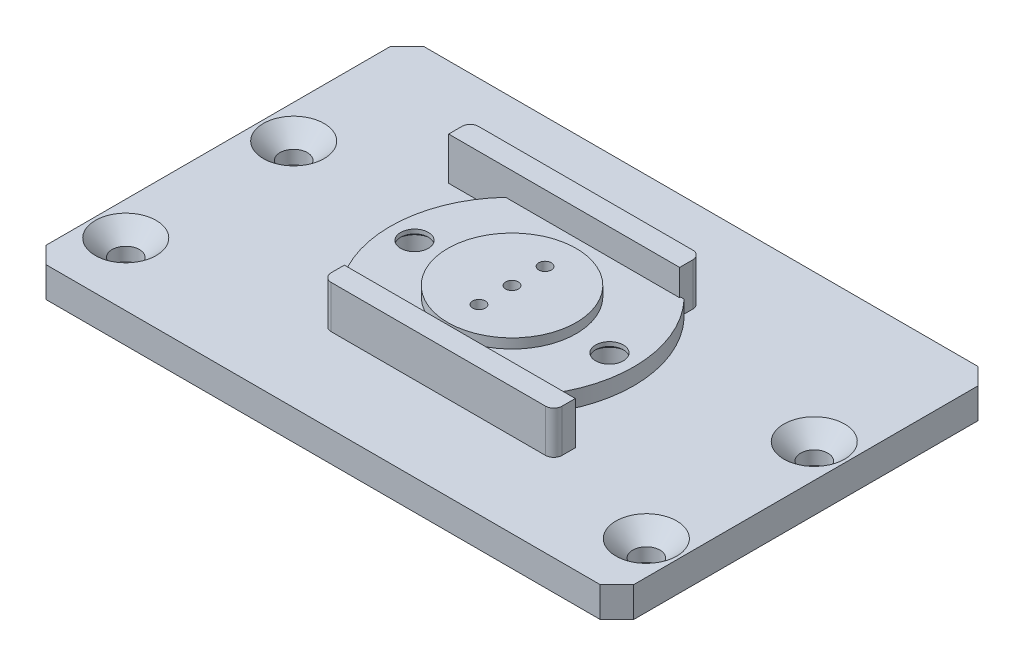
from build123d import *

# Parameters (mm, degrees)
SKETCH1_R           = 7.65
SKETCH1_R_2         = 0.75
BOSS_EXTRUDE1_DEPTH = 3.103
SKETCH1_3_R         = 2.1
SKETCH1_3_R_2       = 7.65
BOSS_EXTRUDE2_DEPTH = 1.95
SKETCH2_W           = 27.509
SKETCH2_H           = 2.566
BOSS_EXTRUDE3_DEPTH = 5.084
BOSS_EXTRUDE4_START = 0.4
SKETCH3_W           = 70
SKETCH3_H           = 45
SKETCH3_R           = 2.1
SKETCH3_R_2         = 1.625
SKETCH3_R_3         = 0.75
BOSS_EXTRUDE4_DEPTH = 0.4
BOSS_EXTRUDE5_START = 3.6
SKETCH3_3_W         = 70
SKETCH3_3_H         = 45
SKETCH3_3_R         = 2.1
SKETCH3_3_R_2       = 6.404
SKETCH3_3_R_3       = 1.625
BOSS_EXTRUDE5_DEPTH = 3.6
FILLET1_R           = 1
BOSS_EXTRUDE7_START = 0.5
SKETCH4_R           = 6.404
SKETCH4_R_2         = 1
BOSS_EXTRUDE7_DEPTH = 0.5
BOSS_EXTRUDE8_START = 0.3
BOSS_EXTRUDE8_DEPTH = 0.3
SKETCH6_R           = 2.125
SKETCH6_R_2         = 1.65
BOSS_EXTRUDE9_DEPTH = 0.5
CHAMFER2_SIZE       = 0.4
CHAMFER3_SIZE       = 2
CHAMFER4_SIZE       = 2


with BuildPart() as part:
    # Sketch1 → Boss-Extrude1 (new body)
    with BuildSketch(Plane(origin=(0, 0, 0), x_dir=(1, 0, 0), z_dir=(0, 1, 0))):
        Circle(SKETCH1_R)
        with Locations((0, -3.937)):
            Circle(SKETCH1_R_2, mode=Mode.SUBTRACT)
        Circle(SKETCH1_R_2, mode=Mode.SUBTRACT)
        with Locations((0, 3.937)):
            Circle(SKETCH1_R_2, mode=Mode.SUBTRACT)
    extrude(amount=BOSS_EXTRUDE1_DEPTH)

    # Sketch1<3> → Boss-Extrude2 (add)
    with BuildSketch(Plane(origin=(0, 0, 0), x_dir=(1, 0, 0), z_dir=(0, 1, 0))):
        with BuildLine():
            ThreePointArc((-10.5, 10), (-14.5, 0), (-10.5, -10))
            Line((-10.5, -10), (10.5, -10))
            ThreePointArc((10.5, -10), (14.5, 0), (10.5, 10))
            Line((10.5, 10), (-10.5, 10))
        make_face()
        with Locations((-11.608, 0)):
            Circle(SKETCH1_3_R, mode=Mode.SUBTRACT)
        with Locations((11.608, 0)):
            Circle(SKETCH1_3_R, mode=Mode.SUBTRACT)
        Circle(SKETCH1_3_R_2, mode=Mode.SUBTRACT)
    extrude(amount=BOSS_EXTRUDE2_DEPTH)

    # Sketch2 → Boss-Extrude3 (add)
    with BuildSketch(Plane.XZ):
        with Locations((3.654588862, 11.149)):
            Rectangle(SKETCH2_W, SKETCH2_H)
        with Locations((-3.654588862, -11.149)):
            Rectangle(SKETCH2_W, SKETCH2_H)
    extrude(amount=-BOSS_EXTRUDE3_DEPTH)

    # Sketch3 → Boss-Extrude4 (add)
    with BuildSketch(Plane.XZ.offset(BOSS_EXTRUDE4_START)):
        Rectangle(SKETCH3_W, SKETCH3_H)
        with Locations((-11.608, 0)):
            Circle(SKETCH3_R, mode=Mode.SUBTRACT)
        with Locations((11.608, 0)):
            Circle(SKETCH3_R, mode=Mode.SUBTRACT)
        with Locations((-31, -5)):
            Circle(SKETCH3_R_2, mode=Mode.SUBTRACT)
        with Locations((31, -5)):
            Circle(SKETCH3_R_2, mode=Mode.SUBTRACT)
        with Locations((-31, 15)):
            Circle(SKETCH3_R_2, mode=Mode.SUBTRACT)
        with Locations((31, 15)):
            Circle(SKETCH3_R_2, mode=Mode.SUBTRACT)
        with Locations((0, 3.937)):
            Circle(SKETCH3_R_3, mode=Mode.SUBTRACT)
        with Locations((0, -3.937)):
            Circle(SKETCH3_R_3, mode=Mode.SUBTRACT)
        Circle(SKETCH3_R_3, mode=Mode.SUBTRACT)
    extrude(amount=-BOSS_EXTRUDE4_DEPTH)

    # Sketch3<3> → Boss-Extrude5 (add)
    with BuildSketch(Plane.XZ.offset(BOSS_EXTRUDE5_START)):
        Rectangle(SKETCH3_3_W, SKETCH3_3_H)
        with Locations((-11.608, 0)):
            Circle(SKETCH3_3_R, mode=Mode.SUBTRACT)
        Circle(SKETCH3_3_R_2, mode=Mode.SUBTRACT)
        with Locations((11.608, 0)):
            Circle(SKETCH3_3_R, mode=Mode.SUBTRACT)
        with Locations((-31, -5)):
            Circle(SKETCH3_3_R_3, mode=Mode.SUBTRACT)
        with Locations((31, -5)):
            Circle(SKETCH3_3_R_3, mode=Mode.SUBTRACT)
        with Locations((-31, 15)):
            Circle(SKETCH3_3_R_3, mode=Mode.SUBTRACT)
        with Locations((31, 15)):
            Circle(SKETCH3_3_R_3, mode=Mode.SUBTRACT)
    extrude(amount=-BOSS_EXTRUDE5_DEPTH)

    # Fillet1
    fillet1_edges = [part.edges().sort_by_distance(p)[0] for p in [
        (-17.409088862, 2.542, -12.432),
        (10.099911138, 2.542, -12.432),
        (17.409088862, 2.542, 12.432),
        (-10.099911138, 2.542, 12.432),
    ]]
    fillet(fillet1_edges, radius=FILLET1_R)

    # Sketch4 → Boss-Extrude7 (add)
    with BuildSketch(Plane.XZ.offset(0.4).offset(BOSS_EXTRUDE7_START)):
        Circle(SKETCH4_R)
        Circle(SKETCH4_R_2, mode=Mode.SUBTRACT)
        with Locations((0, -3.937)):
            Circle(SKETCH4_R_2, mode=Mode.SUBTRACT)
        with Locations((0, 3.937)):
            Circle(SKETCH4_R_2, mode=Mode.SUBTRACT)
    extrude(amount=-BOSS_EXTRUDE7_DEPTH)

    # Sketch5 → Boss-Extrude8 (add)
    with BuildSketch(Plane.XZ.offset(0.9).offset(BOSS_EXTRUDE8_START)):
        with BuildLine():
            Line((-1, -6.325441961), (-1, 6.325441961))
            ThreePointArc((-1, 6.325441961), (-6.404, 0), (-1, -6.325441961))
        make_face()
        with BuildLine():
            ThreePointArc((1, -6.325441961), (6.404, 0), (1, 6.325441961))
            Line((1, 6.325441961), (1, -6.325441961))
        make_face()
    extrude(amount=-BOSS_EXTRUDE8_DEPTH)

    # Sketch6 → Boss-Extrude9 (add)
    # profile 1 of 2: a face of its own
    with BuildSketch(Plane(origin=(0, 1.95, 0), x_dir=(1, 0, 0), z_dir=(0, 1, 0))):
        with Locations((-11.608, 0)):
            Circle(SKETCH6_R)
        with Locations((-11.608, 0)):
            Circle(SKETCH6_R_2, mode=Mode.SUBTRACT)
    # profile 2 of 2: a face of its own
    with BuildSketch(Plane(origin=(0, 1.95, 0), x_dir=(1, 0, 0), z_dir=(0, 1, 0))):
        with Locations((11.608, 0)):
            Circle(SKETCH6_R)
        with Locations((11.608, 0)):
            Circle(SKETCH6_R_2, mode=Mode.SUBTRACT)
    extrude(amount=-BOSS_EXTRUDE9_DEPTH)

    # Chamfer2
    chamfer2_edges = [part.edges().sort_by_distance(p)[0] for p in [
        (-13.708, 1.45, 0),
        (9.508, 1.45, 0),
    ]]
    chamfer(chamfer2_edges, length=CHAMFER2_SIZE)

    # Chamfer3
    chamfer3_edges = [part.edges().sort_by_distance(p)[0] for p in [
        (-35, -1.8, -22.5),
        (35, -1.8, -22.5),
        (-35, -1.8, 22.5),
        (35, -1.8, 22.5),
    ]]
    chamfer(chamfer3_edges, length=CHAMFER3_SIZE)

    # Chamfer4
    chamfer4_edges = [part.edges().sort_by_distance(p)[0] for p in [
        (-32.625, 0, -5),
        (-32.625, 0, 15),
        (29.375, 0, 15),
        (29.375, 0, -5),
    ]]
    chamfer(chamfer4_edges, length=CHAMFER4_SIZE)


solid = part.part
